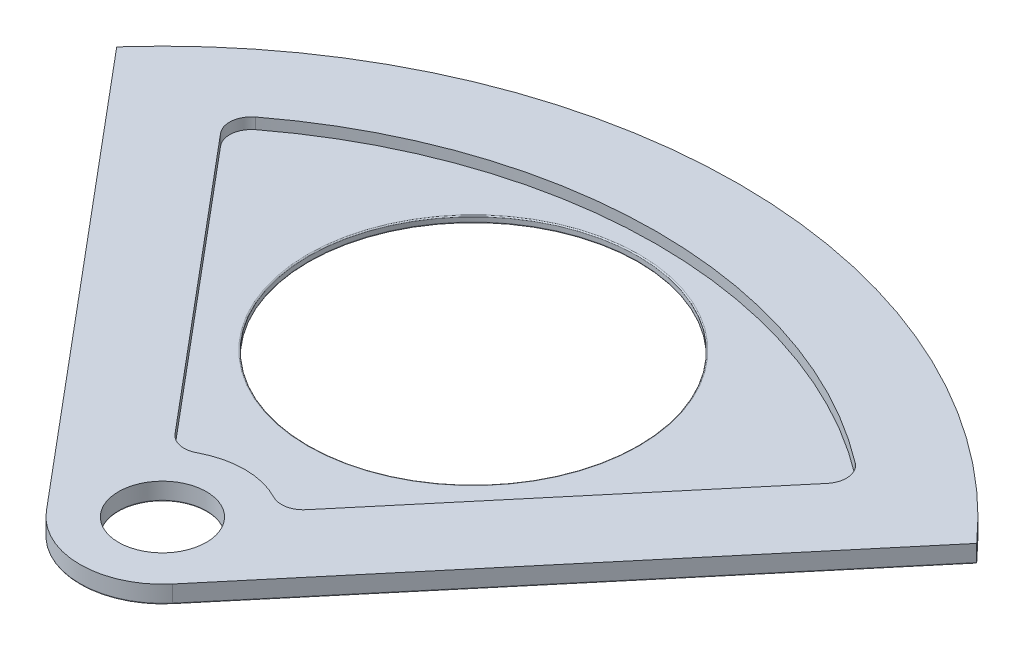
from build123d import *

# Parameters (mm, degrees)
SKETCH1_R           = 10.16
BOSS_EXTRUDE1_DEPTH = 2.54
FILLET1_R           = 5.08
BOSS_EXTRUDE2_START = 1.524
SKETCH2_R           = 10.16
SKETCH2_R_2         = 38.1
BOSS_EXTRUDE2_DEPTH = 1.524
FILLET2_R           = 0.254


with BuildPart() as part:
    # Sketch1 → Boss-Extrude1 (new body)
    with BuildSketch(Plane(origin=(0, 0, 0), x_dir=(1, 0, 0), z_dir=(0, 1, 0))):
        with BuildLine():
            Line((-14.593146641, -12.245103965), (-99.429715484, 88.859181736))
            ThreePointArc((-99.429715484, 88.859181736), (0, 133.35), (99.429715484, 88.859181736))
            Line((99.429715484, 88.859181736), (14.593146641, -12.245103965))
            ThreePointArc((14.593146641, -12.245103965), (0, -19.05), (-14.593146641, -12.245103965))
        make_face()
        Circle(SKETCH1_R, mode=Mode.SUBTRACT)
        with BuildLine():
            Line((-12.245103965, 14.593146641), (-73.470623787, 87.558879848))
            ThreePointArc((-73.470623787, 87.558879848), (0, 114.3), (73.470623787, 87.558879848))
            Line((73.470623787, 87.558879848), (12.245103965, 14.593146641))
            ThreePointArc((12.245103965, 14.593146641), (0, 19.05), (-12.245103965, 14.593146641))
        make_face(mode=Mode.SUBTRACT)
    extrude(amount=BOSS_EXTRUDE1_DEPTH)

    # Fillet1
    fillet1_edges = [part.edges().sort_by_distance(p)[0] for p in [
        (12.245103965, 1.27, -14.593146641),
        (-12.245103965, 1.27, -14.593146641),
        (-73.470623787, 1.27, -87.558879848),
        (73.470623787, 1.27, -87.558879848),
    ]]
    fillet(fillet1_edges, radius=FILLET1_R)

    # Sketch2 → Boss-Extrude2 (add)
    with BuildSketch(Plane.XZ.offset(BOSS_EXTRUDE2_START)):
        with BuildLine():
            Line((-14.593146641, 12.245103965), (-99.429715484, -88.859181736))
            ThreePointArc((-99.429715484, -88.859181736), (0, -133.35), (99.429715484, -88.859181736))
            Line((99.429715484, -88.859181736), (14.593146641, 12.245103965))
            ThreePointArc((14.593146641, 12.245103965), (0, 19.05), (-14.593146641, 12.245103965))
        make_face()
        Circle(SKETCH2_R, mode=Mode.SUBTRACT)
        with Locations((0, -71.891985059)):
            Circle(SKETCH2_R_2, mode=Mode.SUBTRACT)
    extrude(amount=-BOSS_EXTRUDE2_DEPTH)

    # Fillet2
    fillet2_edges = [part.edges().sort_by_distance(p)[0] for p in [
        (-38.1, -1.524, -71.891985059),
        (57.011431062, -1.524, -38.307038886),
        (0, -1.524, -133.35),
        (-57.011431062, -1.524, -38.307038886),
        (0, -1.524, 19.05),
        (-10.16, -1.524, 0),
        (-38.1, 0, -71.891985059),
    ]]
    fillet(fillet2_edges, radius=FILLET2_R)


solid = part.part
